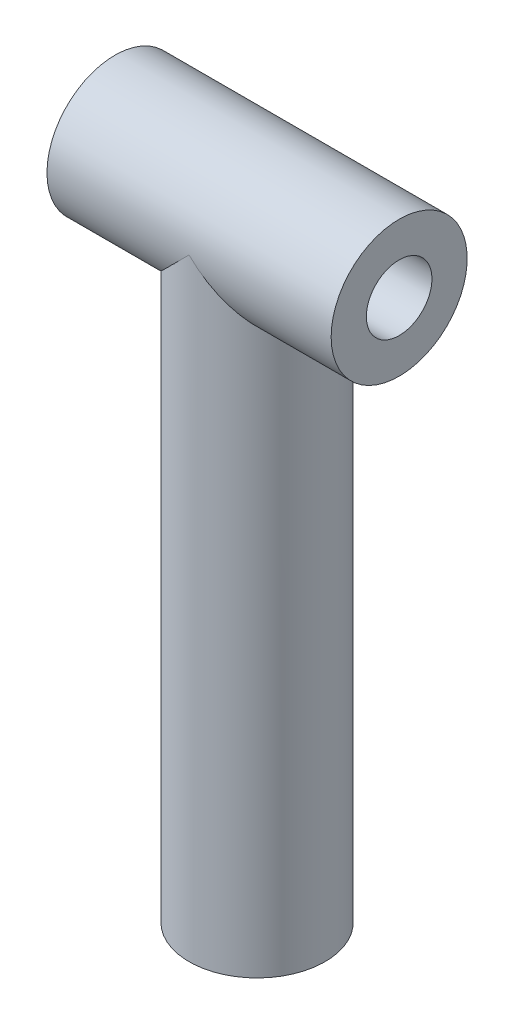
from build123d import *

# Parameters (mm, degrees)
PIPE_START                      = -112
PIPE_26_9_X_3_2_1_OUTLINE_R     = 12.445
PIPE_26_9_X_3_2_1_OUTLINE_R_2   = 5
PIPE_26_9_X_3_2_1_DEPTH         = 99.5549999
PIPE_START_2                    = -12.4450001
PIPE_26_9_X_3_2_1_2_OUTLINE_R   = 12.445
PIPE_26_9_X_3_2_1_2_OUTLINE_R_2 = 5
PIPE_26_9_X_3_2_1_2_DEPTH       = 12.4450002
PIPE_START_3                    = -13
PIPE_26_9_X_3_2_1_3_DEPTH       = 26
PIPE_START_4                    = -26
PIPE_26_9_X_3_2_1_4_OUTLINE_R   = 12.445
PIPE_26_9_X_3_2_1_4_OUTLINE_R_2 = 5
PIPE_26_9_X_3_2_1_4_DEPTH       = 52
SKETCH13_R                      = 6
CUT_EXTRUDE1_DEPTH              = 57


with BuildPart() as part:
    # Pipe 26.9 X 3.2(1): read off the stored shape, not the designer's step
    # Pipe 26.9 X 3.2(1) outline → Pipe 26.9 X 3.2(1) (new body)
    with BuildSketch(Plane(origin=(0, 0, 0), x_dir=(1, 0, 0), z_dir=(0, 1, 0)).offset(PIPE_START)):
        Circle(PIPE_26_9_X_3_2_1_OUTLINE_R)
        Circle(PIPE_26_9_X_3_2_1_OUTLINE_R_2, mode=Mode.SUBTRACT)
    extrude(amount=PIPE_26_9_X_3_2_1_DEPTH)

    # Pipe 26.9 X 3.2_1 2 outline → Pipe 26.9 X 3.2_1 2 (add)
    with BuildSketch(Plane(origin=(0, 0, 0), x_dir=(1, 0, 0), z_dir=(0, 1, 0)).offset(PIPE_START_2)):
        Circle(PIPE_26_9_X_3_2_1_2_OUTLINE_R)
        Circle(PIPE_26_9_X_3_2_1_2_OUTLINE_R_2, mode=Mode.SUBTRACT)
    extrude(amount=PIPE_26_9_X_3_2_1_2_DEPTH)

    # Pipe 26.9 X 3.2_1 3 outline → Pipe 26.9 X 3.2_1 3 (cut)
    with BuildSketch(Plane.YZ.offset(PIPE_START_3)):
        with BuildLine():
            ThreePointArc((0, 12.445), (-12.445, 0), (0, -12.445))
            Line((0, -12.445), (0, 12.445))
        make_face()
    extrude(amount=PIPE_26_9_X_3_2_1_3_DEPTH, mode=Mode.SUBTRACT)


with BuildPart() as body_2:
    # Pipe 26.9 X 3.2_1 4 outline → Pipe 26.9 X 3.2_1 4 (new body)
    with BuildSketch(Plane.YZ.offset(PIPE_START_4)):
        Circle(PIPE_26_9_X_3_2_1_4_OUTLINE_R)
        Circle(PIPE_26_9_X_3_2_1_4_OUTLINE_R_2, mode=Mode.SUBTRACT)
    extrude(amount=PIPE_26_9_X_3_2_1_4_DEPTH)

    # Sketch13 → Cut-Extrude1 (cut)
    with BuildSketch(Plane.ZY.offset(26)):
        Circle(SKETCH13_R)
    extrude(amount=-CUT_EXTRUDE1_DEPTH, mode=Mode.SUBTRACT)


solid = Compound([part.part, body_2.part])
